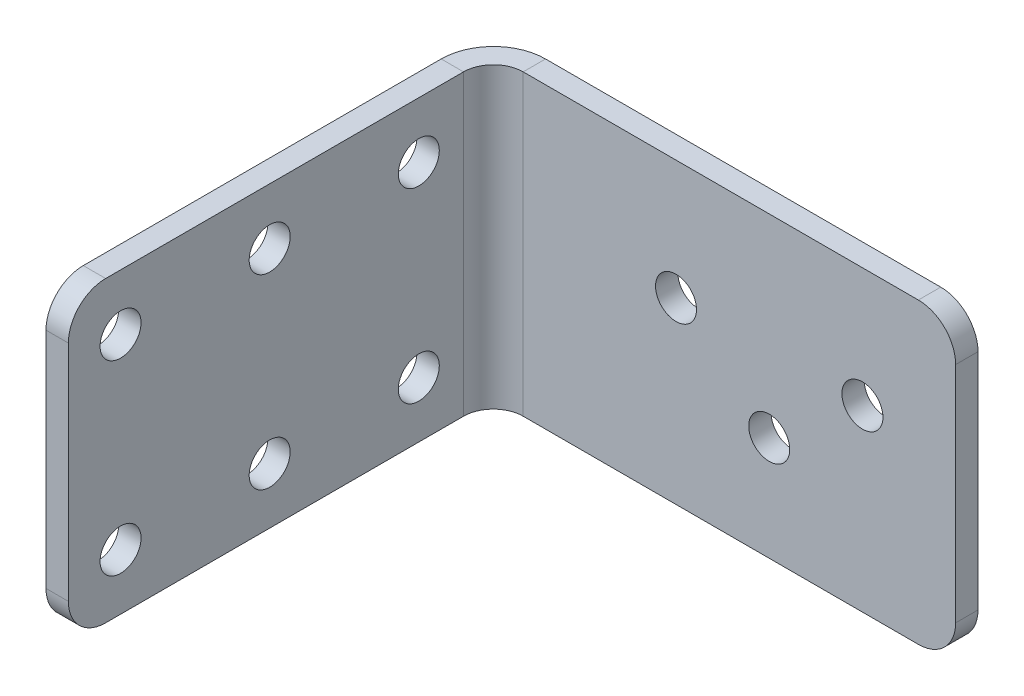
from build123d import *

# Parameters (mm, degrees)
ODGI_CIE_BAZOWE1_DEPTH = 20
OTW_R_POD_RUB_M51_D    = 5.5
OTW_R_POD_RUB_M52_D    = 5.5
ZAOKR_GLENIE1_R        = 5


# Sheet-metal steps are written as plain solids
with BuildPart() as part:
    # Szkic1 → Odgięcie bazowe1 (new, symmetric)
    with BuildSketch(Plane(origin=(0, 0, 0), x_dir=(1, 0, 0), z_dir=(0, 1, 0))):
        with BuildLine():
            Line((0, -60), (0, -7))
            ThreePointArc((0, -7), (2.050252532, -2.050252532), (7, 0))
            Line((7, 0), (65, 0))
            Line((65, 0), (65, -3))
            Line((65, -3), (7, -3))
            ThreePointArc((7, -3), (4.171572875, -4.171572875), (3, -7))
            Line((3, -7), (3, -60))
            Line((3, -60), (0, -60))
        make_face()
    extrude(amount=ODGI_CIE_BAZOWE1_DEPTH, both=True)

    # Otwór pod śrubę M51 (through all)
    with Locations(Plane.XY.offset(3)):
        with Locations((27.5, 4), (40, -6), (52.5, 4)):
            Hole(OTW_R_POD_RUB_M51_D / 2)

    # Otwór pod śrubę M52 (through all)
    with Locations(Plane(origin=(3, 0, 0), x_dir=(0, 0, -1), z_dir=(1, 0, 0))):
        with Locations((-53, 12.5), (-33, 12.5), (-13, 12.5), (-13, -12.5), (-33, -12.5), (-53, -12.5)):
            Hole(OTW_R_POD_RUB_M52_D / 2)

    # Zaokrąglenie1
    zaokr_glenie1_edges = [part.edges().sort_by_distance(p)[0] for p in [
        (65, 20, 1.5),
        (65, -20, 1.5),
        (1.5, 20, 60),
        (1.5, -20, 60),
    ]]
    fillet(zaokr_glenie1_edges, radius=ZAOKR_GLENIE1_R)


solid = part.part
